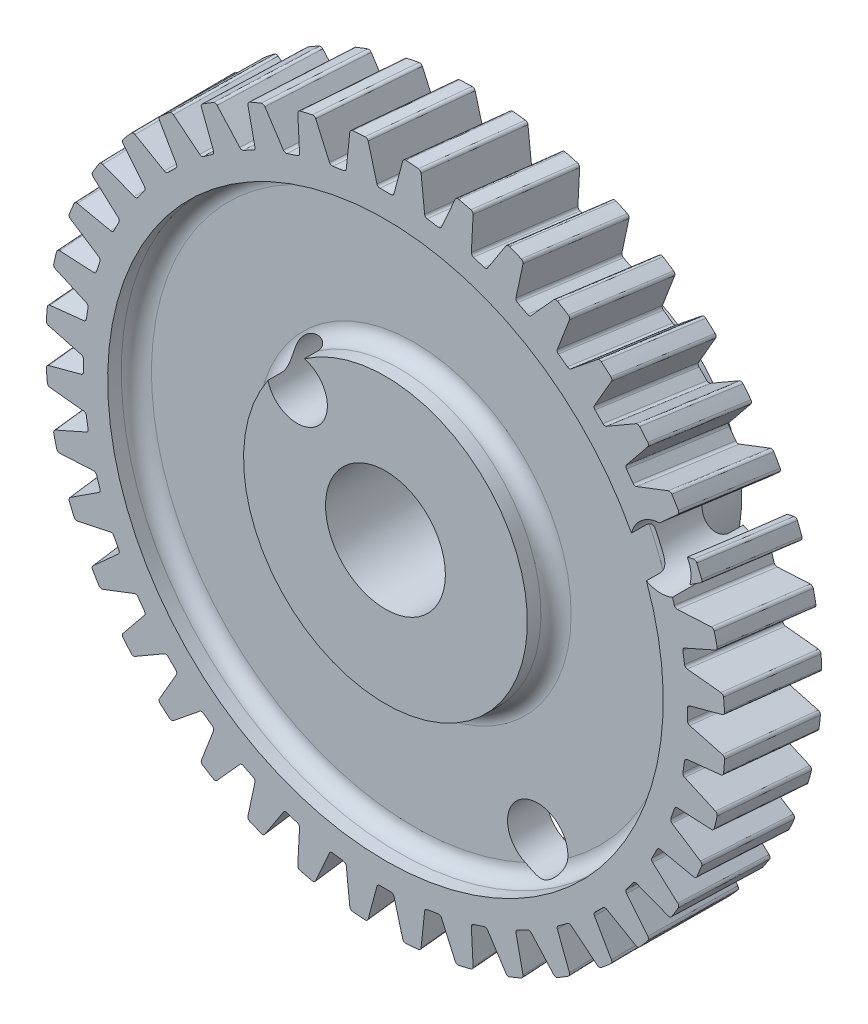
from build123d import *

# Parameters (mm, degrees)
FILLET1_R                = 1
CIRPATTERN1_COUNT        = 40
FILLET2_R                = 0.2
F_4_0_4_DIAMETER_HOLE1_D = 4


with BuildPart() as part:
    # Sketch2 → Revolve1 (revolve)
    with BuildSketch(Plane(origin=(0, 0, 0), x_dir=(0, 0, -1), z_dir=(1, 0, 0))):
        Polygon((11, 3.96875), (-3.2, 3.96875), (-3.2, 9.4), (-1.3, 9.4), (-1.3, 18.4), (-3.2, 18.4), (-3.2, 22.5), (3.2, 22.5), (3.2, 18.4), (1.3, 18.4), (1.3, 9.4), (3.2, 9.4), (11, 9.4), align=None)
    revolve(axis=Axis((0, 0, 0), (0, 0, -1)))

    # Fillet1
    fillet1_edges = [part.edges().sort_by_distance(p)[0] for p in [
        (0, -18.4, 1.3),
        (0, -9.4, 1.3),
        (0, -9.4, -1.3),
        (0, -18.4, -1.3),
    ]]
    fillet(fillet1_edges, radius=FILLET1_R)

    # Cut-Sweep1: sweep along a path in Sketch4
    with BuildLine(Plane(origin=(0, 0, 0), x_dir=(1, 0, 0), z_dir=(0, 1, 0))) as cut_sweep1_path:
        Line((0, -3.2), (0.690971205, 3.2))
    # Sketch3 → Cut-Sweep1 (sweep, cut)
    with BuildSketch(Plane.XY.offset(3.2)):
        Polygon((-0.525, 20), (0.525, 20), (1.246362285, 22.6921607), (-1.246362285, 22.6921607), align=None)
    cut_sweep1 = sweep(path=cut_sweep1_path.line, mode=Mode.SUBTRACT)

    # CirPattern1: Cut-Sweep1 ×40 about axis
    cirpattern1_axis = Axis((0, 0, 3.2), (0, 0, 1))
    for i in range(1, CIRPATTERN1_COUNT):
        add(cut_sweep1.rotate(cirpattern1_axis, i * 360 / CIRPATTERN1_COUNT), mode=Mode.SUBTRACT)

    # Fillet2
    fillet2_edges = [part.edges().sort_by_distance(p)[0] for p in [
        (1.526462518, 22.448160552, 5.3054e-05),
        (0.870485603, 20, 0),
        (-0.845126217, 22.484122435, -6.2808e-05),
        (-2.003996756, 22.410577793, 5.3054e-05),
        (-2.26892082, 19.889940761, 0),
        (-3.305993578, 19.725684573, 0),
        (-4.352012976, 22.07509871, -6.2808e-05),
        (-5.485110979, 21.821172231, 5.3054e-05),
        (-5.352458883, 19.29012517, 0),
        (-6.351068225, 18.965657326, 0),
        (-7.751738732, 21.122512792, -6.2808e-05),
        (-8.831163565, 20.694456989, 5.3054e-05),
        (-8.304201644, 18.215322678, 0),
        (-9.239758494, 17.738632653, 0),
        (-10.960590953, 19.649820507, -6.2808e-05),
        (-11.959763596, 19.058175535, 5.3054e-05),
        (-11.0514674, 16.691998487, 0),
        (-11.900935244, 16.074823972, 0),
        (-13.89955705, 17.693284427, -6.2808e-05),
        (-14.793874554, 16.952618549, 5.3054e-05),
        (-13.526609351, 14.757661896, 0),
        (-14.269071471, 14.015199776, 0),
        (-16.496269922, 15.301080964, -6.2808e-05),
        (-17.263711223, 14.429631832, 5.3054e-05),
        (-15.668681288, 12.459942692, 0),
        (-16.285855803, 11.610474848, 0),
        (-18.68678988, 12.532114106, -6.2808e-05),
        (-19.308458027, 11.55133969, 5.3054e-05),
        (-17.42493829, 9.855418346, 0),
        (-17.901628315, 8.919861496, 0),
        (-20.417179054, 9.454565008, -6.2808e-05),
        (-20.877766513, 8.388615227, 5.3054e-05),
        (-18.752135481, 7.008220892, 0),
        (-19.076603325, 6.00961155, 0),
        (-21.644829518, 6.144213141, -6.2808e-05),
        (-21.932995098, 5.019335218, 5.3054e-05),
        (-19.617592862, 3.988457781, 0),
        (-19.781849051, 2.951385024, 0),
        (-22.339512445, 2.682570354, -6.2808e-05),
        (-22.448160552, 1.526462518, 5.3054e-05),
        (-20, 0.870485603, 0),
        (-20, -0.179514397, 0),
        (-22.484122435, -0.845126217, -6.2808e-05),
        (-22.410577793, -2.003996756, 5.3054e-05),
        (-19.889940761, -2.26892082, 0),
        (-19.725684573, -3.305993578, 0),
        (-22.07509871, -4.352012976, -6.2808e-05),
        (-21.821172231, -5.485110979, 5.3054e-05),
        (-19.29012517, -5.352458883, 0),
        (-18.965657326, -6.351068225, 0),
        (-21.122512792, -7.751738732, -6.2808e-05),
        (-20.694456989, -8.831163565, 5.3054e-05),
        (-18.215322678, -8.304201644, 0),
        (-17.738632653, -9.239758494, 0),
        (-19.649820507, -10.960590953, -6.2808e-05),
        (-19.058175535, -11.959763596, 5.3054e-05),
        (-16.691998487, -11.0514674, 0),
        (-16.074823972, -11.900935244, 0),
        (-17.693284427, -13.89955705, -6.2808e-05),
        (-16.952618549, -14.793874554, 5.3054e-05),
        (-14.757661896, -13.526609351, 0),
        (-14.015199776, -14.269071471, 0),
        (-15.301080964, -16.496269922, -6.2808e-05),
        (-14.429631832, -17.263711223, 5.3054e-05),
        (-12.459942692, -15.668681288, 0),
        (-11.610474848, -16.285855803, 0),
        (-12.532114106, -18.68678988, -6.2808e-05),
        (-11.55133969, -19.308458027, 5.3054e-05),
        (-9.855418346, -17.42493829, 0),
        (-8.919861496, -17.901628315, 0),
        (-9.454565008, -20.417179054, -6.2808e-05),
        (-8.388615227, -20.877766513, 5.3054e-05),
        (-7.008220892, -18.752135481, 0),
        (-6.00961155, -19.076603325, 0),
        (-6.144213141, -21.644829518, -6.2808e-05),
        (-5.019335218, -21.932995098, 5.3054e-05),
        (-3.988457781, -19.617592862, 0),
        (-2.951385024, -19.781849051, 0),
        (-2.682570354, -22.339512445, -6.2808e-05),
        (-1.526462518, -22.448160552, 5.3054e-05),
        (-0.870485603, -20, 0),
        (0.179514397, -20, 0),
        (0.845126217, -22.484122435, -6.2808e-05),
        (2.003996756, -22.410577793, 5.3054e-05),
        (2.26892082, -19.889940761, 0),
        (3.305993578, -19.725684573, 0),
        (4.352012976, -22.07509871, -6.2808e-05),
        (5.485110979, -21.821172231, 5.3054e-05),
        (5.352458883, -19.29012517, 0),
        (6.351068225, -18.965657326, 0),
        (7.751738732, -21.122512792, -6.2808e-05),
        (8.831163565, -20.694456989, 5.3054e-05),
        (8.304201644, -18.215322678, 0),
        (9.239758494, -17.738632653, 0),
        (10.960590953, -19.649820507, -6.2808e-05),
        (11.959763596, -19.058175535, 5.3054e-05),
        (11.0514674, -16.691998487, 0),
        (11.900935244, -16.074823972, 0),
        (13.89955705, -17.693284427, -6.2808e-05),
        (14.793874554, -16.952618549, 5.3054e-05),
        (13.526609351, -14.757661896, 0),
        (14.269071471, -14.015199776, 0),
        (16.496269922, -15.301080964, -6.2808e-05),
        (17.263711223, -14.429631832, 5.3054e-05),
        (15.668681288, -12.459942692, 0),
        (16.285855803, -11.610474848, 0),
        (18.68678988, -12.532114106, -6.2808e-05),
        (19.308458027, -11.55133969, 5.3054e-05),
        (17.42493829, -9.855418346, 0),
        (17.901628315, -8.919861496, 0),
        (20.417179054, -9.454565008, -6.2808e-05),
        (20.877766513, -8.388615227, 5.3054e-05),
        (18.752135481, -7.008220892, 0),
        (19.076603325, -6.00961155, 0),
        (21.644829518, -6.144213141, -6.2808e-05),
        (21.932995098, -5.019335218, 5.3054e-05),
        (19.617592862, -3.988457781, 0),
        (19.781849051, -2.951385024, 0),
        (22.339512445, -2.682570354, -6.2808e-05),
        (22.448160552, -1.526462518, 5.3054e-05),
        (20, -0.870485603, 0),
        (20, 0.179514397, 0),
        (22.484122435, 0.845126217, -6.2808e-05),
        (22.410577793, 2.003996756, 5.3054e-05),
        (19.889940761, 2.26892082, 0),
        (19.725684573, 3.305993578, 0),
        (22.07509871, 4.352012976, -6.2808e-05),
        (21.821172231, 5.485110979, 5.3054e-05),
        (19.29012517, 5.352458883, 0),
        (18.965657326, 6.351068225, 0),
        (21.122512792, 7.751738732, -6.2808e-05),
        (20.694456989, 8.831163565, 5.3054e-05),
        (18.215322678, 8.304201644, 0),
        (17.738632653, 9.239758494, 0),
        (19.649820507, 10.960590953, -6.2808e-05),
        (19.058175535, 11.959763596, 5.3054e-05),
        (16.691998487, 11.0514674, 0),
        (16.074823972, 11.900935244, 0),
        (17.693284427, 13.89955705, -6.2808e-05),
        (16.952618549, 14.793874554, 5.3054e-05),
        (14.757661896, 13.526609351, 0),
        (14.015199776, 14.269071471, 0),
        (15.301080964, 16.496269922, -6.2808e-05),
        (14.429631832, 17.263711223, 5.3054e-05),
        (12.459942692, 15.668681288, 0),
        (11.610474848, 16.285855803, 0),
        (12.532114106, 18.68678988, -6.2808e-05),
        (11.55133969, 19.308458027, 5.3054e-05),
        (9.855418346, 17.42493829, 0),
        (8.919861496, 17.901628315, 0),
        (9.454565008, 20.417179054, -6.2808e-05),
        (8.388615227, 20.877766513, 5.3054e-05),
        (7.008220892, 18.752135481, 0),
        (6.00961155, 19.076603325, 0),
        (6.144213141, 21.644829518, -6.2808e-05),
        (5.019335218, 21.932995098, 5.3054e-05),
        (3.988457781, 19.617592862, 0),
        (2.951385024, 19.781849051, 0),
        (2.682570354, 22.339512445, -6.2808e-05),
        (-0.179514397, 20, 0),
    ]]
    fillet(fillet2_edges, radius=FILLET2_R)

    # Ø4.0 (4) Diameter Hole1 (through all)
    with Locations(Plane(origin=(66.617802584, -178.239954308, 3.9366), x_dir=(0.9999854958897523, -0.005385908477352911, 0), z_dir=(0, 0, 1))):
        with Locations((-73.454863948, 183.614199593), (-49.38231875, 186.041234274), (-59.31671766, 163.980281258)):
            Hole(F_4_0_4_DIAMETER_HOLE1_D / 2)


solid = part.part
